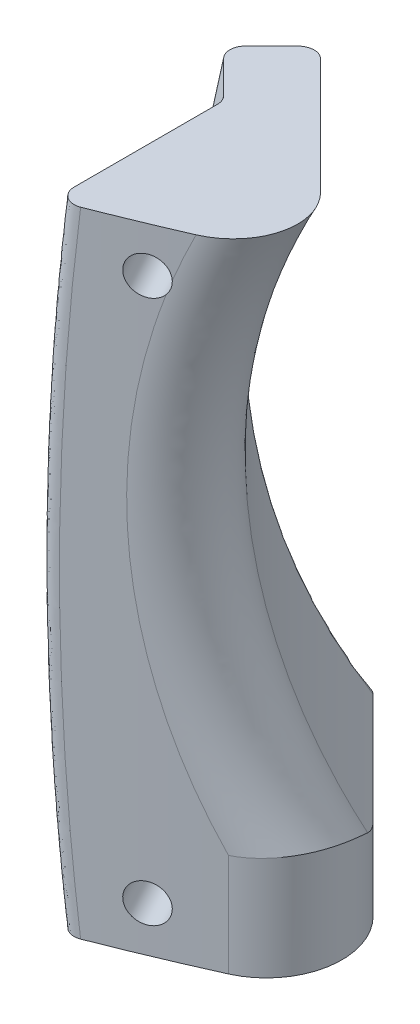
from build123d import *
from OCP.BRepFilletAPI import BRepFilletAPI_MakeFillet

# Parameters (mm, degrees)
BOSS_EXTRUDE1_DEPTH     = 42
CUT_EXTRUDE2_REACH      = 72.389
SKETCH3_R               = 38
FILLET1_R1              = 4
FILLET1_R2              = 5
CUT_EXTRUDE6_DEPTH      = 3
CUT_EXTRUDE7_REACH      = 283.065
CUT_EXTRUDE7_END_RADIUS = 111.25
CUT_EXTRUDE7_START      = 128.62348
FILLET2_R               = 1
SKETCH9_R               = 1.25
CUT_EXTRUDE8_DEPTH      = 7
SKETCH10_R              = 1.25
CUT_EXTRUDE9_DEPTH      = 8


with BuildPart() as part:
    # Sketch1 → Boss-Extrude1 (new body)
    with BuildSketch(Plane(origin=(0, 0, 0), x_dir=(1, 0, 0), z_dir=(0, 1, 0))):
        with BuildLine():
            Line((50, -116.87720036), (50, -128.623481527))
            ThreePointArc((50, -128.623481527), (62.079244864, -124.320549352), (73.746853427, -119.001687423))
            Line((73.746853427, -119.001687423), (60.811183182, -106.066017178))
            Line((60.811183182, -106.066017178), (50, -116.87720036))
        make_face()
    extrude(amount=BOSS_EXTRUDE1_DEPTH)

    # Sketch3 → Cut-Extrude2 (cut, up to next)
    with BuildSketch(Plane(origin=(96.374270425, 0, 96.374270425), x_dir=(0, -1, 0), z_dir=(0.7071067811865487, 0, 0.7071067811865464)), mode=Mode.PRIVATE) as cut_extrude2_sk1:
        with Locations((-26, 0)):
            Circle(SKETCH3_R)
    cut_extrude2_tool1 = extrude(cut_extrude2_sk1.sketch, amount=-CUT_EXTRUDE2_REACH, mode=Mode.PRIVATE) & part.part
    add(cut_extrude2_tool1.solids().sort_by_distance((96.37427, 26, 96.37427))[0], mode=Mode.SUBTRACT)

    # Fillet1: one fillet with a radius per group of edges: ONE call of the kernel's fillet builder (fillet() takes one radius for all edges)
    fillet1_edges_1 = [part.edges().sort_by_distance(p)[0] for p in [
        (68.10818897, 23.403756036, 121.722730244),
    ]]
    fillet1_edges_2 = [part.edges().sort_by_distance(p)[0] for p in [
        (73.746853427, 2.753049234, 119.001687423),
        (73.746853427, 2.753049234, 119.001687423),
    ]]
    fillet1 = BRepFilletAPI_MakeFillet(part.part.solid().wrapped)
    for e in fillet1_edges_1:
        fillet1.Add(FILLET1_R1, e.wrapped)
    for e in fillet1_edges_2:
        fillet1.Add(FILLET1_R2, e.wrapped)
    add(Compound.cast(fillet1.Shape()), mode=Mode.REPLACE)

    # Sketch7 → Cut-Extrude6 (cut)
    with BuildSketch(Plane(origin=(83.43860018, 0, 83.43860018), x_dir=(-0.7071067811865465, 0, 0.7071067811865486), z_dir=(-0.7071067811865486, 0, -0.7071067811865465))):
        with BuildLine():
            Line((39, 42), (55.595196948, 42))
            Line((55.595196948, 42), (55.595196948, 0))
            Line((55.595196948, 0), (39, 0))
            ThreePointArc((39, 0), (41, 21), (39, 42))
        make_face()
    extrude(amount=-CUT_EXTRUDE6_DEPTH, mode=Mode.SUBTRACT)

    # Cut-Extrude7: up to this cylinder (the profile starts outside it)
    cut_extrude7_end = Plane(origin=(141.071914378, 21, 41.723411622), z_dir=(-0.7071067811865486, 0, -0.7071067811865465)) * Cylinder(CUT_EXTRUDE7_END_RADIUS, 789.63, mode=Mode.PRIVATE)
    # Sketch8 → Cut-Extrude7 (cut, up to the surface)
    with BuildSketch(Plane.XY.offset(CUT_EXTRUDE7_START), mode=Mode.PRIVATE) as cut_extrude7_sk1:
        with BuildLine():
            Line((59, 42), (50, 42))
            Line((50, 42), (50, 0))
            Line((50, 0), (59, 0))
            ThreePointArc((59, 0), (58, 21), (59, 42))
        make_face()
    cut_extrude7_tool1 = extrude(cut_extrude7_sk1.sketch, amount=-CUT_EXTRUDE7_REACH, mode=Mode.PRIVATE) - cut_extrude7_end
    add(cut_extrude7_tool1.solids().sort_by_distance((54.171846, 21, 128.62348))[0], mode=Mode.SUBTRACT)

    # Fillet2
    fillet2_edges = [part.edges().sort_by_distance(p)[0] for p in [
        (60.811183182, 2.753049234, 106.066017178),
        (56.629746919, 23.436647961, 110.247453441),
        (54.447222151, 21, 112.429978209),
        (58, 21, 115.982756057),
        (58, 21, 125.904514152),
    ]]
    fillet(fillet2_edges, radius=FILLET2_R)

    # Sketch9 → Cut-Extrude8 (cut)
    with BuildSketch(Plane(origin=(65.594185868, 0, 123.364721335), x_dir=(0, -1, 0), z_dir=(0.4694715627858925, 0, 0.882947592858926))):
        with Locations((-39, -2)):
            Circle(SKETCH9_R)
        with Locations((-3, -2)):
            Circle(SKETCH9_R)
    extrude(amount=-CUT_EXTRUDE8_DEPTH, mode=Mode.SUBTRACT)

    # Sketch10 → Cut-Extrude9 (cut)
    with BuildSketch(Plane.XZ):
        with Locations((65, 119)):
            Circle(SKETCH10_R)
        with Locations((60, 111)):
            Circle(SKETCH10_R)
    extrude(amount=-CUT_EXTRUDE9_DEPTH, mode=Mode.SUBTRACT)


solid = part.part
